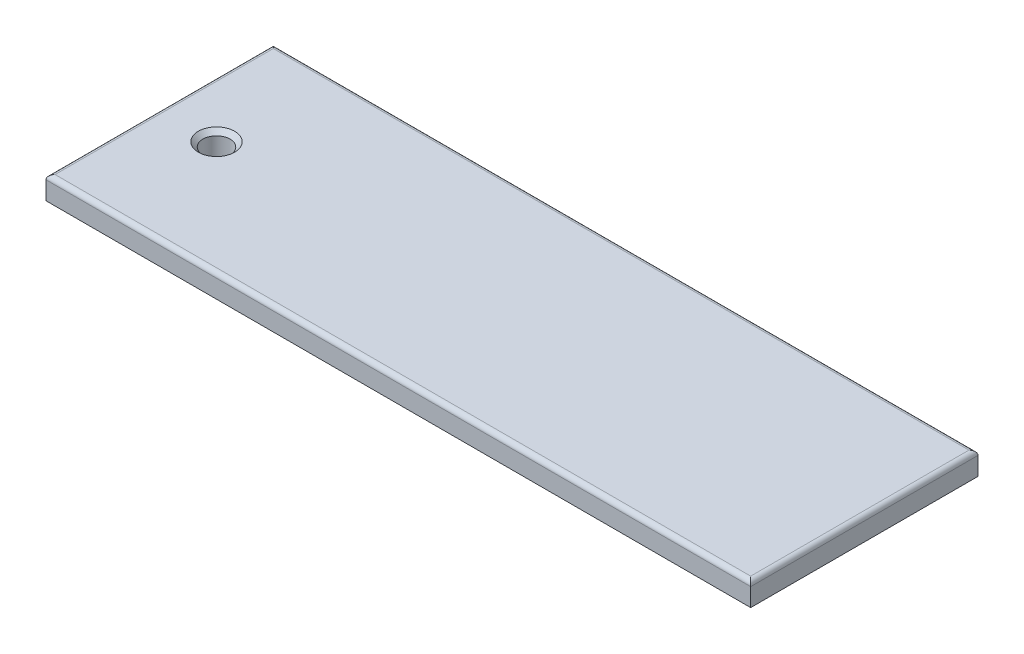
from build123d import *

# Parameters (mm, degrees)
SKETCH1_W           = 310
SKETCH1_H           = 100
BOSS_EXTRUDE1_DEPTH = 10
FILLET1_R           = 2
SKETCH2_R           = 6
CUT_EXTRUDE1_DEPTH  = 164.171688721
CHAMFER1_SIZE       = 2


with BuildPart() as part:
    # Sketch1 → Boss-Extrude1 (new body)
    with BuildSketch(Plane(origin=(0, 0, 0), x_dir=(1, 0, 0), z_dir=(0, 1, 0))):
        Rectangle(SKETCH1_W, SKETCH1_H)
    extrude(amount=BOSS_EXTRUDE1_DEPTH)

    # Fillet1
    fillet1_edges = [part.edges().sort_by_distance(p)[0] for p in [
        (-155, 10, 0),
        (0, 10, -50),
        (155, 10, 0),
        (0, 10, 50),
    ]]
    fillet(fillet1_edges, radius=FILLET1_R)

    # Sketch2 → Cut-Extrude1 (cut, through all)
    with BuildSketch(Plane(origin=(0, 10, 0), x_dir=(1, 0, 0), z_dir=(0, 1, 0))):
        with Locations((-130, 0)):
            Circle(SKETCH2_R)
    extrude(amount=-CUT_EXTRUDE1_DEPTH, mode=Mode.SUBTRACT)

    # Chamfer1
    chamfer1_edges = [part.edges().sort_by_distance(p)[0] for p in [
        (-136, 10, 0),
    ]]
    chamfer(chamfer1_edges, length=CHAMFER1_SIZE)


solid = part.part
